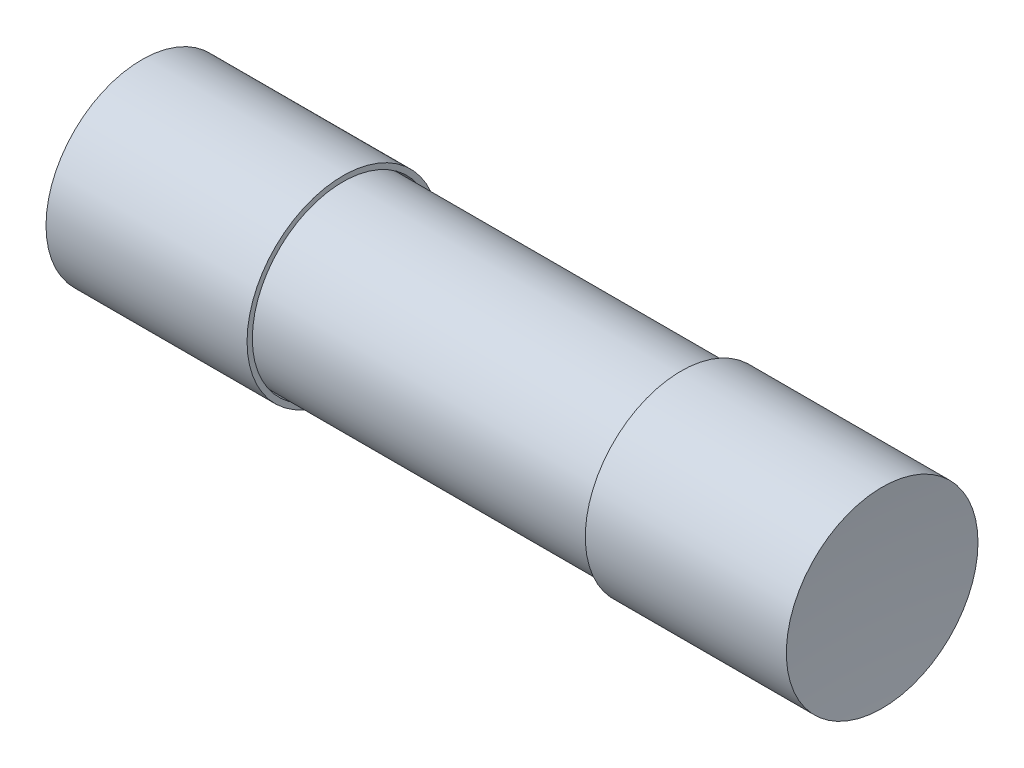
from build123d import *

# Parameters (mm, degrees)
EXTRUDE1_DEPTH      = 9.75
EXTRUDE1_DEPTH_BACK = 9.75
SKETCH1_R           = 2.375
SHELL1_T            = -0.2
EXTRUDE2_DEPTH      = 9.65
EXTRUDE2_DEPTH_BACK = 9.65
SKETCH2_R           = 0.05
EXTRUDE3_DEPTH      = 0.1
EXTRUDE3_DEPTH_BACK = 5.25
SKETCH3_R           = 2.55
SHELL3_T            = -0.14
EXTRUDE5_DEPTH      = 0.1
EXTRUDE5_DEPTH_BACK = 5.25
SKETCH5_R           = 2.55
SHELL6_T            = -0.14


# Read off the part's stored shape, not the designer's step: Dome2, Dome3
with BuildPart() as part:
    # Sketch1 → Extrude1 (new, two sides: drawn at the far end of the back side and taken through both)
    with BuildSketch(Plane(origin=(0, 0, 0), x_dir=(0, 0, -1), z_dir=(1, 0, 0)).offset(-EXTRUDE1_DEPTH_BACK)):
        Circle(SKETCH1_R)
    extrude(amount=EXTRUDE1_DEPTH + EXTRUDE1_DEPTH_BACK)

    # Shell1
    shell1_openings = [part.faces().sort_by_distance(p)[0] for p in [
        (-9.75, 0, 0),
        (9.75, 0, 0),
    ]]
    offset(amount=SHELL1_T, openings=shell1_openings, kind=Kind.INTERSECTION)


with BuildPart() as body_2:
    # Sketch2 → Extrude2 (new, two sides: drawn at the far end of the back side and taken through both)
    with BuildSketch(Plane(origin=(0, 0, 0), x_dir=(0, 0, -1), z_dir=(1, 0, 0)).offset(-EXTRUDE2_DEPTH_BACK)):
        Circle(SKETCH2_R)
    extrude(amount=EXTRUDE2_DEPTH + EXTRUDE2_DEPTH_BACK)


with BuildPart() as body_3:
    # Sketch3 → Extrude3 (new, two sides: drawn at the far end of the back side and taken through both)
    with BuildSketch(Plane(origin=(9.75, 0, 0), x_dir=(0, 0, -1), z_dir=(1, 0, 0)).offset(-EXTRUDE3_DEPTH_BACK)):
        Circle(SKETCH3_R)
    extrude(amount=EXTRUDE3_DEPTH + EXTRUDE3_DEPTH_BACK)

    # Shell3
    shell3_openings = [body_3.faces().sort_by_distance(p)[0] for p in [
        (4.5, 0, 0),
    ]]
    offset(amount=SHELL3_T, openings=shell3_openings)

    # Dome2 outline → Dome2 (revolve, cut)
    with BuildSketch(Plane.YX):
        with BuildLine():
            Line((0, 9.850000003), (0, 9.75))
            ThreePointArc((0, 9.75), (1.275980032, 9.775009605), (2.550000032, 9.850000003))
            Line((2.550000032, 9.850000003), (0, 9.850000003))
        make_face()
    revolve(axis=Axis((0, 0, 0), (1, 0, 0)), mode=Mode.SUBTRACT)


with BuildPart() as body_4:
    # Sketch5 → Extrude5 (new, two sides: drawn at the far end of the back side and taken through both)
    with BuildSketch(Plane.ZY.offset(9.75).offset(-EXTRUDE5_DEPTH_BACK)):
        Circle(SKETCH5_R)
    extrude(amount=EXTRUDE5_DEPTH + EXTRUDE5_DEPTH_BACK)

    # Shell6
    shell6_openings = [body_4.faces().sort_by_distance(p)[0] for p in [
        (-4.5, 0, 0),
    ]]
    offset(amount=SHELL6_T, openings=shell6_openings)

    # Dome3 outline → Dome3 (revolve, cut)
    with BuildSketch(Plane.YX):
        with BuildLine():
            Line((0, -9.85), (2.550000032, -9.850000003))
            ThreePointArc((2.550000032, -9.850000003), (1.275980032, -9.775009605), (0, -9.75))
            Line((0, -9.75), (0, -9.85))
        make_face()
    revolve(axis=Axis((0, 0, 0), (1, 0, 0)), mode=Mode.SUBTRACT)


solid = Compound([part.part, body_2.part, body_3.part, body_4.part])
